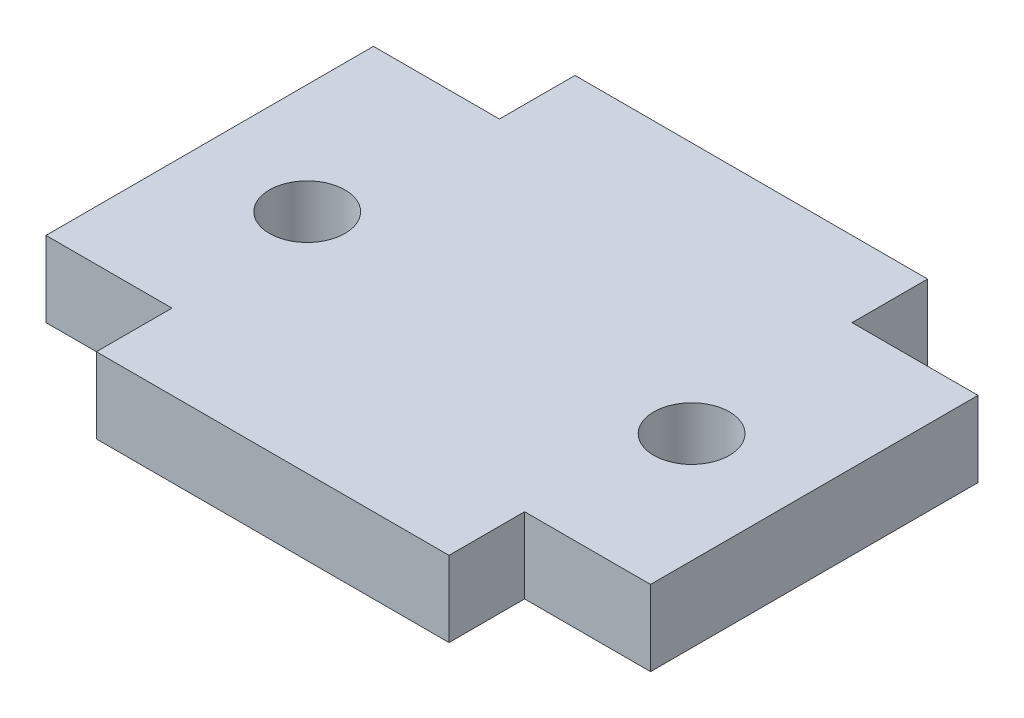
from build123d import *

# Parameters (mm, degrees)
CROQUIS1_R              = 1.5
SALIENTE_EXTRUIR1_DEPTH = 3


with BuildPart() as part:
    # Croquis1 → Saliente-Extruir1 (new body)
    with BuildSketch(Plane(origin=(0, 0, 0), x_dir=(1, 0, 0), z_dir=(0, 1, 0))):
        Polygon((0, 0), (0, 13), (5, 13), (5, 16), (19, 16), (19, 13), (24, 13), (24, 0), (19, 0), (19, -3), (5, -3), (5, 0), align=None)
        with Locations((4.37, 6)):
            Circle(CROQUIS1_R, mode=Mode.SUBTRACT)
        with Locations((19.63, 6)):
            Circle(CROQUIS1_R, mode=Mode.SUBTRACT)
    extrude(amount=SALIENTE_EXTRUIR1_DEPTH)


solid = part.part
